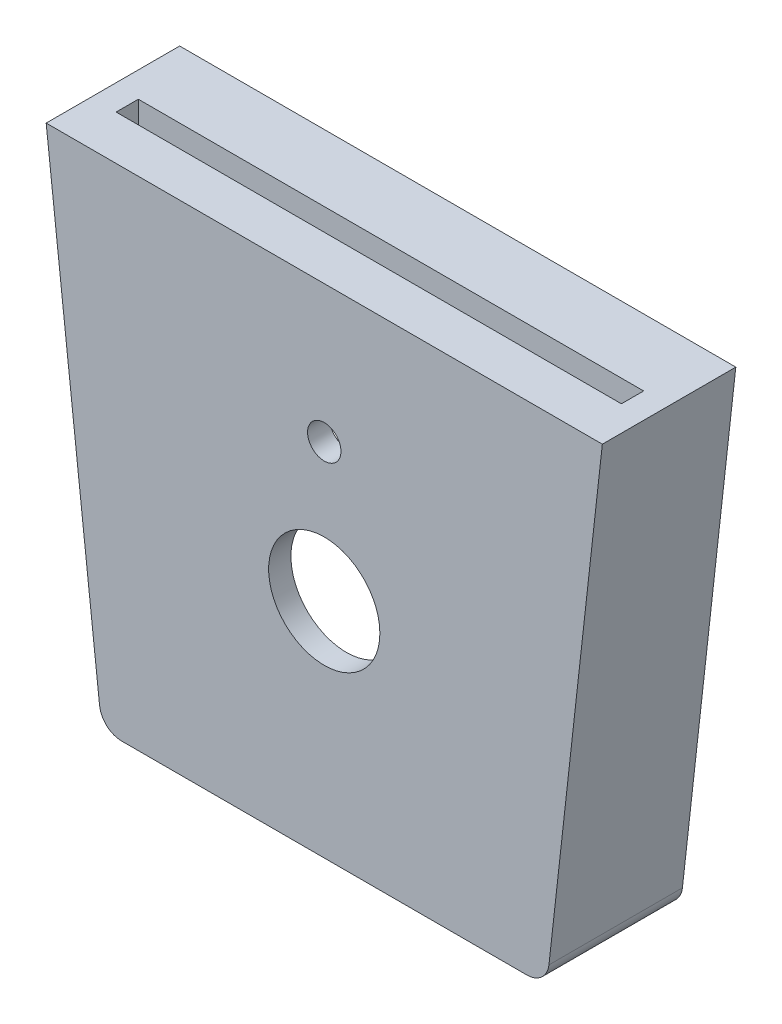
from build123d import *

# Parameters (mm, degrees)
SKETCH1_R           = 3.81
SKETCH1_R_2         = 12.7
BOSS_EXTRUDE1_DEPTH = 5.08
BOSS_EXTRUDE2_DEPTH = 25.4
SKETCH3_W           = 115.38555028
SKETCH3_H           = 5.08
CUT_EXTRUDE2_DEPTH  = 6.35
BOSS_EXTRUDE3_DEPTH = 2.54
SKETCH5_R           = 1.905
CUT_EXTRUDE3_DEPTH  = 2.54


with BuildPart() as part:
    # Sketch1 → Boss-Extrude1 (new body)
    with BuildSketch(Plane.XY):
        with BuildLine():
            Line((63.5, 56.7961272), (-63.5, 56.7961272))
            Line((-63.5, 56.7961272), (-51.304854459, -52.280570501))
            ThreePointArc((-51.304854459, -52.280570501), (-49.642976536, -55.502534499), (-46.25630987, -56.796126057))
            Line((-46.25630987, -56.796126057), (46.25630987, -56.796126057))
            ThreePointArc((46.25630987, -56.796126057), (49.642976536, -55.502534499), (51.304854459, -52.280570501))
            Line((51.304854459, -52.280570501), (63.5, 56.7961272))
        make_face()
        with Locations((0, 25.51645392)):
            Circle(SKETCH1_R, mode=Mode.SUBTRACT)
        with Locations((0, -5.996126057)):
            Circle(SKETCH1_R_2, mode=Mode.SUBTRACT)
    extrude(amount=-BOSS_EXTRUDE1_DEPTH)

    # Sketch2 → Boss-Extrude2 (add)
    with BuildSketch(Plane.XY.offset(-5.08)):
        with BuildLine():
            Line((63.5, 56.7961272), (-63.5, 56.7961272))
            Line((-63.5, 56.7961272), (-51.304854459, -52.280570501))
            ThreePointArc((-51.304854459, -52.280570501), (-49.642976536, -55.502534499), (-46.25630987, -56.796126057))
            Line((-46.25630987, -56.796126057), (46.25630987, -56.796126057))
            ThreePointArc((46.25630987, -56.796126057), (49.642976536, -55.502534499), (51.304854459, -52.280570501))
            Line((51.304854459, -52.280570501), (63.5, 56.7961272))
        make_face()
        with BuildLine():
            Line((41.712619739, -51.716126057), (-41.712619739, -51.716126057))
            ThreePointArc((-41.712619739, -51.716126057), (-45.099286406, -50.422534499), (-46.761164329, -47.200570501))
            Line((-46.761164329, -47.200570501), (-57.820387337, 51.7161272))
            Line((-57.820387337, 51.7161272), (57.820387337, 51.7161272))
            Line((57.820387337, 51.7161272), (46.761164329, -47.200570501))
            ThreePointArc((46.761164329, -47.200570501), (45.099286406, -50.422534499), (41.712619739, -51.716126057))
        make_face(mode=Mode.SUBTRACT)
    extrude(amount=-BOSS_EXTRUDE2_DEPTH)

    # Sketch3 → Cut-Extrude2 (cut)
    with BuildSketch(Plane(origin=(0, 56.7961272, 0), x_dir=(1, 0, 0), z_dir=(0, 1, 0))):
        with Locations((2.54e-06, 12.7)):
            Rectangle(SKETCH3_W, SKETCH3_H)
    extrude(amount=-CUT_EXTRUDE2_DEPTH, mode=Mode.SUBTRACT)

    # Sketch4 → Boss-Extrude3 (add)
    with BuildSketch(Plane(origin=(0, 0, -30.48), x_dir=(-1, 0, 0), z_dir=(0, 0, -1))):
        Polygon((-52.99583525, 8.564021488), (-33.94583525, 8.564021488), (-33.94583525, -4.135978512), (-51.575932084, -4.135978512), align=None)
        Polygon((33.94583525, -4.135978512), (51.575932084, -4.135978512), (52.99583525, 8.564021488), (33.94583525, 8.564021488), align=None)
    extrude(amount=-BOSS_EXTRUDE3_DEPTH)

    # Sketch5 → Cut-Extrude3 (cut)
    with BuildSketch(Plane(origin=(0, 0, -30.48), x_dir=(-1, 0, 0), z_dir=(0, 0, -1))):
        with Locations((-43.115859459, 2.214021488)):
            Circle(SKETCH5_R)
        with Locations((43.115859459, 2.214021488)):
            Circle(SKETCH5_R)
    extrude(amount=-CUT_EXTRUDE3_DEPTH, mode=Mode.SUBTRACT)


solid = part.part
